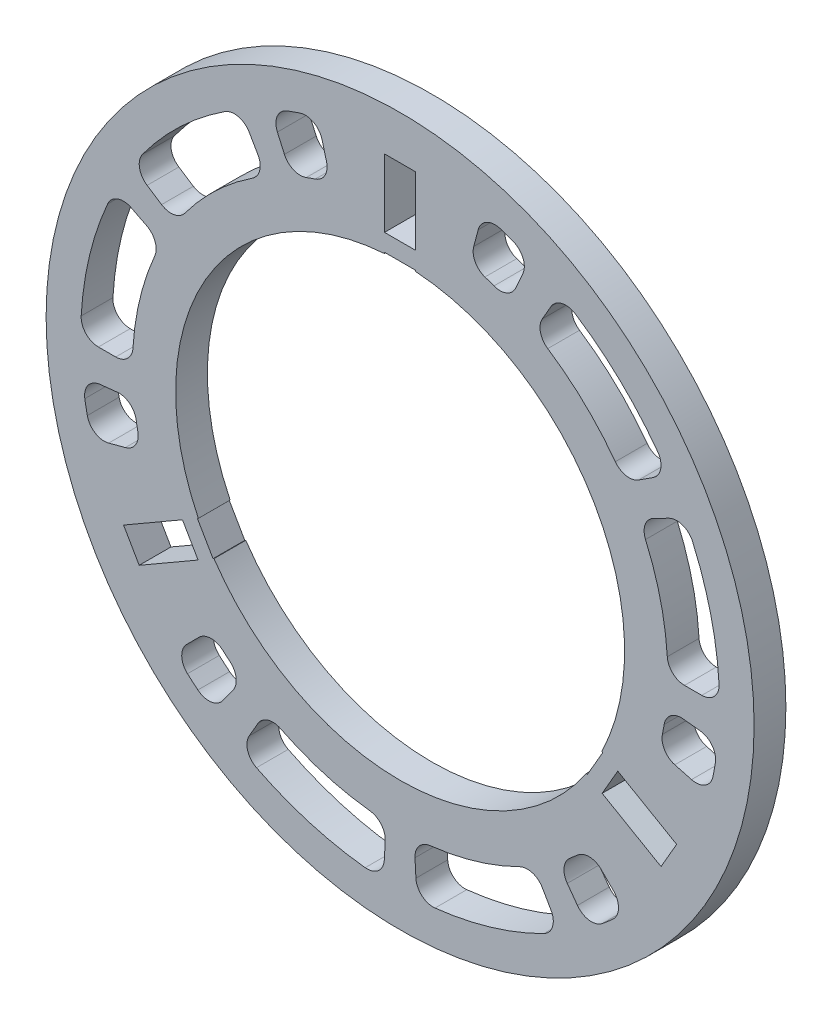
from build123d import *

# Parameters (mm, degrees)
SKETCH1_R           = 65.0875
SKETCH1_W           = 5.742
SKETCH1_H           = 12.5
BOSS_EXTRUDE1_DEPTH = 5.842
CUT_EXTRUDE2_DEPTH  = 93.232826458
FILLET1_R           = 3.175


with BuildPart() as part:
    # Sketch1 → Boss-Extrude1 (new body)
    with BuildSketch(Plane.XY):
        Circle(SKETCH1_R)
        Polygon((47.971249286, -31.011358934), (50.842249286, -26.038641066), (40.016931739, -19.788641066), (37.145931739, -24.761358934), align=None, mode=Mode.SUBTRACT)
        with Locations((0, 50.8)):
            Rectangle(SKETCH1_W, SKETCH1_H, mode=Mode.SUBTRACT)
        Polygon((-50.842249286, -26.038641066), (-47.971249286, -31.011358934), (-37.145931739, -24.761358934), (-40.016931739, -19.788641066), align=None, mode=Mode.SUBTRACT)
        with BuildLine():
            Line((-2.871, 41.375), (2.871, 41.375))
            Line((2.871, 41.375), (2.871, 41.175028646))
            ThreePointArc((2.871, 41.175028646), (35.745198541, 20.6375), (37.094120809, -18.101155389))
            Line((37.094120809, -18.101155389), (37.267301082, -18.201141066))
            Line((37.267301082, -18.201141066), (34.396301082, -23.173858934))
            Line((34.396301082, -23.173858934), (34.223120809, -23.073873257))
            ThreePointArc((34.223120809, -23.073873257), (0, -41.275), (-34.223120809, -23.073873257))
            Line((-34.223120809, -23.073873257), (-34.396301082, -23.173858934))
            Line((-34.396301082, -23.173858934), (-37.267301082, -18.201141066))
            Line((-37.267301082, -18.201141066), (-37.094120809, -18.101155389))
            ThreePointArc((-37.094120809, -18.101155389), (-35.745198541, 20.6375), (-2.871, 41.175028646))
            Line((-2.871, 41.175028646), (-2.871, 41.375))
        make_face(mode=Mode.SUBTRACT)
    extrude(amount=BOSS_EXTRUDE1_DEPTH)

    # Sketch3 → Cut-Extrude2 (cut, through all)
    with BuildSketch(Plane.XY.offset(5.842)):
        with BuildLine():
            ThreePointArc((-41.273075325, 26.803048511), (-33.875649556, 35.697486233), (-24.60625, 42.619275184))
            Line((-24.60625, 42.619275184), (-29.36875, 50.868167155))
            ThreePointArc((-29.36875, 50.868167155), (-40.43222689, 42.606677117), (-49.261412485, 31.990735319))
            Line((-49.261412485, 31.990735319), (-41.273075325, 26.803048511))
        make_face()
        with BuildLine():
            Line((-58.7375, 0), (-49.2125, 0))
            ThreePointArc((-49.2125, 0), (-47.852754708, 11.488429969), (-43.848658572, 22.342007468))
            Line((-43.848658572, 22.342007468), (-52.335495715, 26.666266978))
            ThreePointArc((-52.335495715, 26.666266978), (-57.114578199, 13.711997059), (-58.7375, 0))
        make_face()
        with BuildLine():
            Line((52.335495715, 26.666266978), (43.848658572, 22.342007468))
            ThreePointArc((43.848658572, 22.342007468), (47.852754708, 11.488429969), (49.2125, 0))
            Line((49.2125, 0), (58.7375, 0))
            ThreePointArc((58.7375, 0), (57.114578199, 13.711997059), (52.335495715, 26.666266978))
        make_face()
        with BuildLine():
            ThreePointArc((24.60625, 42.619275184), (33.875649556, 35.697486233), (41.273075325, 26.803048511))
            Line((41.273075325, 26.803048511), (49.261412485, 31.990735319))
            ThreePointArc((49.261412485, 31.990735319), (40.43222689, 42.606677117), (29.36875, 50.868167155))
            Line((29.36875, 50.868167155), (24.60625, 42.619275184))
        make_face()
        with BuildLine():
            Line((-3.07408323, -58.657002298), (-2.575583247, -49.145055979))
            ThreePointArc((-2.575583247, -49.145055979), (-13.977105151, -47.185916202), (-24.60625, -42.619275184))
            Line((-24.60625, -42.619275184), (-29.36875, -50.868167155))
            ThreePointArc((-29.36875, -50.868167155), (-16.68235131, -56.318674177), (-3.07408323, -58.657002298))
        make_face()
        with BuildLine():
            ThreePointArc((24.60625, -42.619275184), (13.977105151, -47.185916202), (2.575583247, -49.145055979))
            Line((2.575583247, -49.145055979), (3.07408323, -58.657002298))
            ThreePointArc((3.07408323, -58.657002298), (16.68235131, -56.318674177), (29.36875, -50.868167155))
            Line((29.36875, -50.868167155), (24.60625, -42.619275184))
        make_face()
        with BuildLine():
            Line((-23.890693573, 53.659376318), (-20.016527047, 44.957855834))
            ThreePointArc((-20.016527047, 44.957855834), (-16.42747006, 46.38974438), (-12.737132257, 47.535624726))
            Line((-12.737132257, 47.535624726), (-15.202383662, 56.736068222))
            ThreePointArc((-15.202383662, 56.736068222), (-19.606980394, 55.368404583), (-23.890693573, 53.659376318))
        make_face()
        with BuildLine():
            ThreePointArc((-58.415729829, -6.139740611), (-57.753935133, -10.704059179), (-56.736068222, -15.202383662))
            Line((-56.736068222, -15.202383662), (-47.535624726, -12.737132257))
            ThreePointArc((-47.535624726, -12.737132257), (-48.388432138, -8.968265798), (-48.942908776, -5.144106999))
            Line((-48.942908776, -5.144106999), (-58.415729829, -6.139740611))
        make_face()
        with BuildLine():
            Line((58.415729829, -6.139740611), (48.942908776, -5.144106999))
            ThreePointArc((48.942908776, -5.144106999), (48.388432138, -8.968265798), (47.535624726, -12.737132257))
            Line((47.535624726, -12.737132257), (56.736068222, -15.202383662))
            ThreePointArc((56.736068222, -15.202383662), (57.753935133, -10.704059179), (58.415729829, -6.139740611))
        make_face()
        with BuildLine():
            ThreePointArc((23.890693573, 53.659376318), (19.606980394, 55.368404583), (15.202383662, 56.736068222))
            Line((15.202383662, 56.736068222), (12.737132257, 47.535624726))
            ThreePointArc((12.737132257, 47.535624726), (16.42747006, 46.38974438), (20.016527047, 44.957855834))
            Line((20.016527047, 44.957855834), (23.890693573, 53.659376318))
        make_face()
        with BuildLine():
            Line((-34.525036257, -47.519635707), (-28.926381728, -39.813748836))
            ThreePointArc((-28.926381728, -39.813748836), (-31.960962078, -37.421478582), (-34.798492469, -34.798492469))
            Line((-34.798492469, -34.798492469), (-41.53368456, -41.53368456))
            ThreePointArc((-41.53368456, -41.53368456), (-38.146954739, -44.664345404), (-34.525036257, -47.519635707))
        make_face()
        with BuildLine():
            ThreePointArc((34.525036257, -47.519635707), (38.146954739, -44.664345404), (41.53368456, -41.53368456))
            Line((41.53368456, -41.53368456), (34.798492469, -34.798492469))
            ThreePointArc((34.798492469, -34.798492469), (31.960962078, -37.421478582), (28.926381728, -39.813748836))
            Line((28.926381728, -39.813748836), (34.525036257, -47.519635707))
        make_face()
    extrude(amount=-CUT_EXTRUDE2_DEPTH, mode=Mode.SUBTRACT)

    # Fillet1
    fillet1_edges = [part.edges().sort_by_distance(p)[0] for p in [
        (-52.335495715, 26.666266978, 2.921),
        (-58.415729829, -6.139740611, 2.921),
        (-43.848658572, 22.342007468, 2.921),
        (-48.942908776, -5.144106999, 2.921),
        (-58.7375, 0, 2.921),
        (-56.736068222, -15.202383662, 2.921),
        (-47.535624726, -12.737132257, 2.921),
        (-49.2125, 0, 2.921),
        (-41.273075325, 26.803048511, 2.921),
        (-49.261412485, 31.990735319, 2.921),
        (-20.016527047, 44.957855834, 2.921),
        (-12.737132257, 47.535624726, 2.921),
        (-15.202383662, 56.736068222, 2.921),
        (-23.890693573, 53.659376318, 2.921),
        (-29.36875, 50.868167155, 2.921),
        (-24.60625, 42.619275184, 2.921),
        (41.53368456, -41.53368456, 2.921),
        (34.525036257, -47.519635707, 2.921),
        (34.798492469, -34.798492469, 2.921),
        (28.926381728, -39.813748836, 2.921),
        (3.07408323, -58.657002298, 2.921),
        (2.575583247, -49.145055979, 2.921),
        (24.60625, -42.619275184, 2.921),
        (29.36875, -50.868167155, 2.921),
        (-3.07408323, -58.657002298, 2.921),
        (-2.575583247, -49.145055979, 2.921),
        (-29.36875, -50.868167155, 2.921),
        (-24.60625, -42.619275184, 2.921),
        (-28.926381728, -39.813748836, 2.921),
        (-41.53368456, -41.53368456, 2.921),
        (-34.798492469, -34.798492469, 2.921),
        (-34.525036257, -47.519635707, 2.921),
        (48.942908776, -5.144106999, 2.921),
        (58.415729829, -6.139740611, 2.921),
        (56.736068222, -15.202383662, 2.921),
        (47.535624726, -12.737132257, 2.921),
        (58.7375, 0, 2.921),
        (49.2125, 0, 2.921),
        (52.335495715, 26.666266978, 2.921),
        (43.848658572, 22.342007468, 2.921),
        (49.261412485, 31.990735319, 2.921),
        (41.273075325, 26.803048511, 2.921),
        (29.36875, 50.868167155, 2.921),
        (23.890693573, 53.659376318, 2.921),
        (15.202383662, 56.736068222, 2.921),
        (24.60625, 42.619275184, 2.921),
        (12.737132257, 47.535624726, 2.921),
        (20.016527047, 44.957855834, 2.921),
    ]]
    fillet(fillet1_edges, radius=FILLET1_R)


solid = part.part
